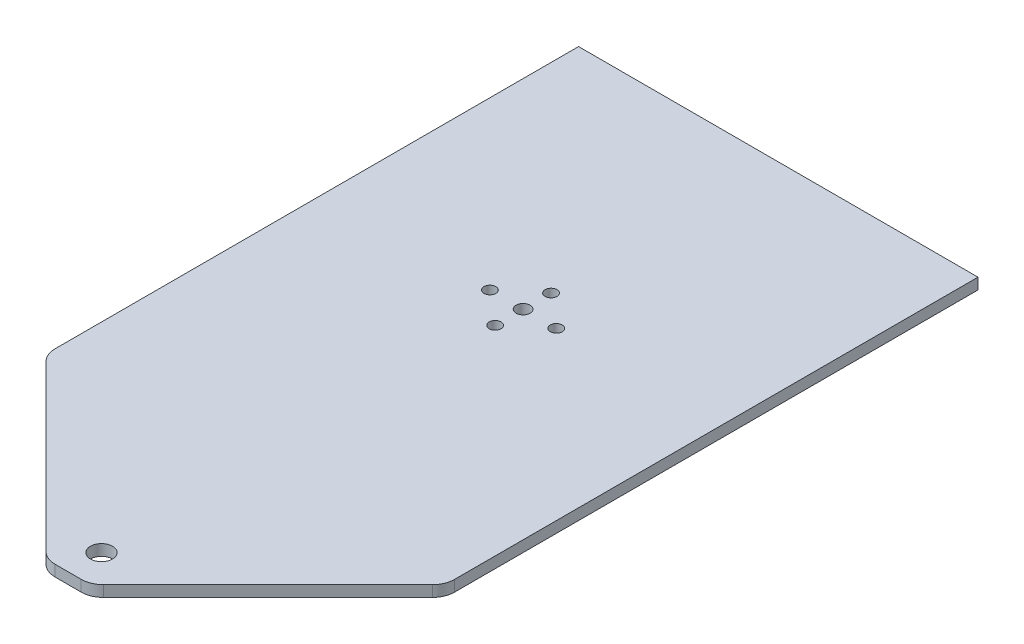
from build123d import *

# Parameters (mm, degrees)
SKETCH1_R               = 3.175
BOSS_EXTRUDE1_DEPTH     = 3.175
CUT_EXTRUDE1_REACH      = 213.108
SKETCH2_R               = 2
ADVANCEDHOLE1_OUTLINE_R = 1.7
ADVANCEDHOLE1_DEPTH     = 3.175


# Read off the part's stored shape, not the designer's step: AdvancedHole1
with BuildPart() as part:
    # Sketch1 → Boss-Extrude1 (new body)
    with BuildSketch(Plane(origin=(0, 0, 0), x_dir=(1, 0, 0), z_dir=(0, 1, 0))):
        with BuildLine():
            Line((-57.15, 0), (57.15, 0))
            Line((57.15, 0), (57.15, -149.769743879))
            ThreePointArc((57.15, -149.769743879), (56.666635031, -152.199783674), (55.290128061, -154.259871939))
            Line((55.290128061, -154.259871939), (8.209871939, -201.340128061))
            ThreePointArc((8.209871939, -201.340128061), (6.149783674, -202.716635031), (3.719743879, -203.2))
            Line((3.719743879, -203.2), (-3.719743879, -203.2))
            ThreePointArc((-3.719743879, -203.2), (-6.149783674, -202.716635031), (-8.209871939, -201.340128061))
            Line((-8.209871939, -201.340128061), (-55.290128061, -154.259871939))
            ThreePointArc((-55.290128061, -154.259871939), (-56.666635031, -152.199783674), (-57.15, -149.769743879))
            Line((-57.15, -149.769743879), (-57.15, 0))
        make_face()
        with Locations(Location((0, -193.675, 0), (0, 0, 270))):
            Circle(SKETCH1_R, mode=Mode.SUBTRACT)
    extrude(amount=BOSS_EXTRUDE1_DEPTH)

    # Sketch2 → Cut-Extrude1 (cut, up to next)
    with BuildSketch(Plane(origin=(0, 3.175, 0), x_dir=(1, 0, 0), z_dir=(0, 1, 0)), mode=Mode.PRIVATE) as cut_extrude1_sk1:
        with Locations(Location((0, -73.025, 0), (0, 0, 270))):
            Circle(SKETCH2_R)
    cut_extrude1_tool1 = extrude(cut_extrude1_sk1.sketch, amount=-CUT_EXTRUDE1_REACH, mode=Mode.PRIVATE) & part.part
    add(cut_extrude1_tool1.solids().sort_by_distance((0, 3.175, 73.025))[0], mode=Mode.SUBTRACT)

    # AdvancedHole1 outline → AdvancedHole1 (cut)
    with BuildSketch(Plane(origin=(0, 0, 0), x_dir=(1, 0, 0), z_dir=(0, 1, 0))):
        with Locations((9.5, -73.025)):
            Circle(ADVANCEDHOLE1_OUTLINE_R)
        with Locations((0, -81.025)):
            Circle(ADVANCEDHOLE1_OUTLINE_R)
        with Locations((-9.5, -73.025)):
            Circle(ADVANCEDHOLE1_OUTLINE_R)
        with Locations((0, -65.025)):
            Circle(ADVANCEDHOLE1_OUTLINE_R)
    extrude(amount=ADVANCEDHOLE1_DEPTH, mode=Mode.SUBTRACT)


solid = part.part
